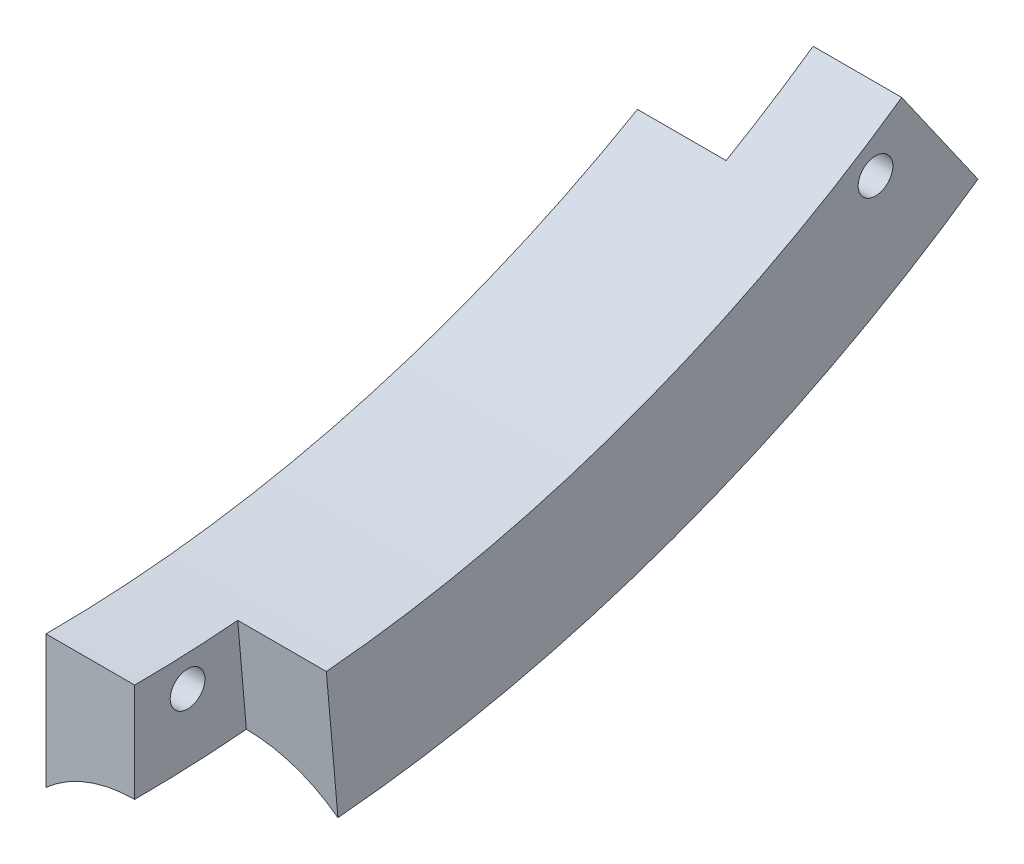
from build123d import *

# Parameters (mm, degrees)
REVOLVE1_ANGLE             = 35
CUT_EXTRUDE1_DEPTH         = 12.7
CUT_EXTRUDE2_DEPTH         = 12.7
F_9_0_196_DIAMETER_HOLE1_D = 4.9784


with BuildPart() as part:
    # Sketch1 → Revolve1 (revolve)
    with BuildSketch(Plane(origin=(0, 0, 0), x_dir=(0, 1, 0), z_dir=(0, 0, 1))):
        with BuildLine():
            Line((0, 0), (0, 25.4))
            Line((0, 25.4), (-19.05, 25.4))
            ThreePointArc((-19.05, 25.4), (-14.199031657, 12.7), (-19.05, 0))
            Line((-19.05, 0), (0, 0))
        make_face()
    revolve(axis=Axis((-25.4, 169.5196, 0), (1, 0, 0)), revolution_arc=REVOLVE1_ANGLE)

    # Sketch2 → Cut-Extrude1 (cut)
    with BuildSketch(Plane.YZ):
        with BuildLine():
            Line((-19.05, 0), (169.5196, 0))
            Line((169.5196, 0), (-18.332435741, -16.434923548))
            ThreePointArc((-18.332435741, -16.434923548), (-18.870523524, -8.225290428), (-19.05, 0))
        make_face()
    extrude(amount=-CUT_EXTRUDE1_DEPTH, mode=Mode.SUBTRACT)

    # Sketch3 → Cut-Extrude2 (cut)
    with BuildSketch(Plane(origin=(-25.4, 0, 0), x_dir=(0, -1, 0), z_dir=(-1, 0, 0))):
        with BuildLine():
            Line((-15.052426669, -108.159079172), (-169.5196, 0))
            Line((-169.5196, 0), (-6.213536019, -94.2848))
            ThreePointArc((-6.213536019, -94.2848), (-10.48161242, -101.318372226), (-15.052426669, -108.159079172))
        make_face()
    extrude(amount=-CUT_EXTRUDE2_DEPTH, mode=Mode.SUBTRACT)

    # #9 (0.196) Diameter Hole1 (through all)
    with Locations(Plane.YZ):
        with Locations((22.799344486, -93.471111446), (-4.279424248, -7.588229275)):
            Hole(F_9_0_196_DIAMETER_HOLE1_D / 2)


solid = part.part
